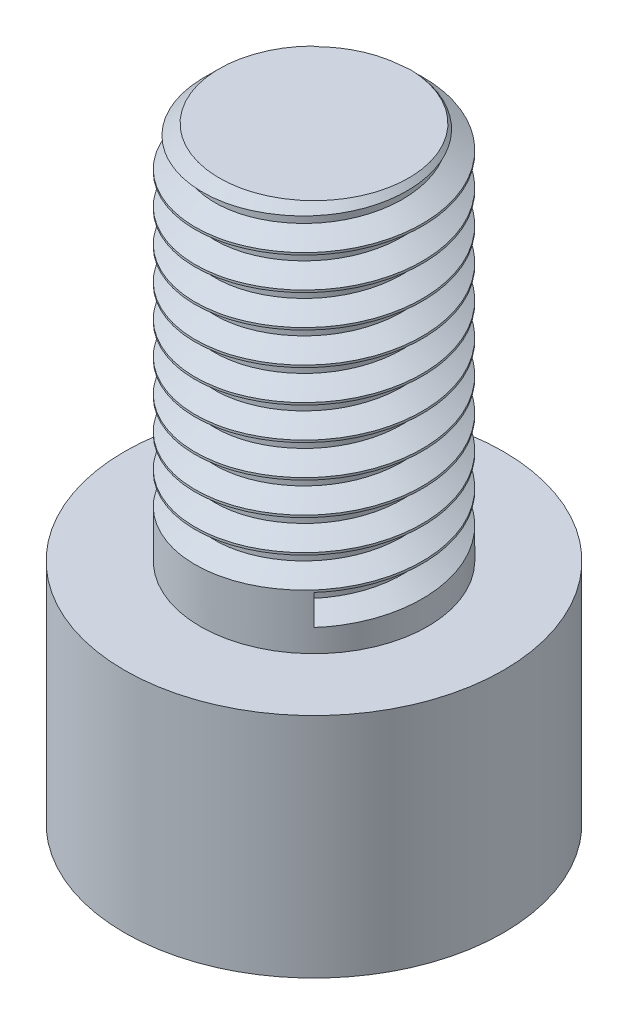
from build123d import *

# Parameters (mm, degrees)
IZIM1_R                     = 2.5
Y_KSEKLIK_EKSTR_ZYON2_DEPTH = 3
IZIM3_R                     = 1.5
Y_KSEKLIK_EKSTR_ZYON3_DEPTH = 5
PAH1_SIZE                   = 0.25
KES_S_P_R3_PITCH            = 0.428571429


with BuildPart() as part:
    # Çizim1 → Yükseklik-Ekstrüzyon2 (new body)
    with BuildSketch(Plane(origin=(0, 0, 0), x_dir=(1, 0, 0), z_dir=(0, 1, 0))):
        with Locations(Location((0, 0, 0), (0, 0, 270))):
            Circle(IZIM1_R)
    extrude(amount=Y_KSEKLIK_EKSTR_ZYON2_DEPTH)

    # Çizim3 → Yükseklik-Ekstrüzyon3 (add)
    with BuildSketch(Plane(origin=(0, 3, 0), x_dir=(1, 0, 0), z_dir=(0, 1, 0))):
        with Locations(Location((0, 0, 0), (0, 0, 270))):
            Circle(IZIM3_R)
    extrude(amount=Y_KSEKLIK_EKSTR_ZYON3_DEPTH)

    # Pah1
    pah1_edges = [part.edges().sort_by_distance(p)[0] for p in [
        (0, 8, -1.5),
    ]]
    chamfer(pah1_edges, length=PAH1_SIZE)

    # Kes-Süpür3: the profile of Çizim6 profile screwed along a right-hand helix of 10.5 turns, 6 arcs to a turn; built about Z, then put on its axis
    kes_s_p_r3_z = Axis((0, 0, 0), (0, 0, 1))
    kes_s_p_r3_corners = [(1.5003, 0, -0.200173205), (1.5003, 0, 0.200173205), (1.240192379, 0, 0.05), (1.240192379, 0, -0.05)]
    with BuildLine(mode=Mode.PRIVATE) as kes_s_p_r3_profile:
        Line(kes_s_p_r3_corners[0], kes_s_p_r3_corners[1])
        Line(kes_s_p_r3_corners[1], kes_s_p_r3_corners[2])
        Line(kes_s_p_r3_corners[2], kes_s_p_r3_corners[3])
        Line(kes_s_p_r3_corners[3], kes_s_p_r3_corners[0])
    kes_s_p_r3_cap = Face(kes_s_p_r3_profile.wire())
    kes_s_p_r3_turn_angles = [0, 30, 60, 90, 120, 150, 180, 210, 240, 270, 300, 330, 360]
    kes_s_p_r3_turn_weights = [1, 0.8660254037844387, 1, 0.8660254037844387, 1, 0.8660254037844387, 1, 0.8660254037844387, 1, 0.8660254037844387, 1, 0.8660254037844387, 1]
    kes_s_p_r3_turn_rails = [Edge.make_bspline([Vector(p[0], p[1], 0).rotate(kes_s_p_r3_z, kes_s_p_r3_turn_angles[k]) / kes_s_p_r3_turn_weights[k] + Vector(0, 0, p[2] + KES_S_P_R3_PITCH * kes_s_p_r3_turn_angles[k] / 360) for k in range(13)], [0, 0, 0, 1, 1, 2, 2, 3, 3, 4, 4, 5, 5, 6, 6, 6], 2, kes_s_p_r3_turn_weights) for p in kes_s_p_r3_corners]
    kes_s_p_r3_turn_sides = [Face.make_surface_from_curves(kes_s_p_r3_turn_rails[p[0]], kes_s_p_r3_turn_rails[p[1]]) for p in [(0, 1), (1, 2), (2, 3), (3, 0)]]
    kes_s_p_r3_last_angles = [3600, 3630, 3660, 3690, 3720, 3750, 3780]
    kes_s_p_r3_last_weights = [1, 0.8660254037844387, 1, 0.8660254037844387, 1, 0.8660254037844546, 1]
    kes_s_p_r3_last_rails = [Edge.make_bspline([Vector(p[0], p[1], 0).rotate(kes_s_p_r3_z, kes_s_p_r3_last_angles[k]) / kes_s_p_r3_last_weights[k] + Vector(0, 0, p[2] + KES_S_P_R3_PITCH * kes_s_p_r3_last_angles[k] / 360) for k in range(7)], [0, 0, 0, 1, 1, 2, 2, 3, 3, 3], 2, kes_s_p_r3_last_weights) for p in kes_s_p_r3_corners]
    kes_s_p_r3_last_sides = [Face.make_surface_from_curves(kes_s_p_r3_last_rails[p[0]], kes_s_p_r3_last_rails[p[1]]) for p in [(0, 1), (1, 2), (2, 3), (3, 0)]]
    kes_s_p_r3 = Plane(origin=(0, 8, 0), x_dir=(-0.7071067811865538, 0, -0.7071067811865414), z_dir=(0, -1, 0)) * Solid(Shell([*[p.moved(Location((0, 0, KES_S_P_R3_PITCH * i))) for i in range(10) for p in kes_s_p_r3_turn_sides], *kes_s_p_r3_last_sides, kes_s_p_r3_cap, kes_s_p_r3_cap.rotate(kes_s_p_r3_z, 3780).moved(Location((0, 0, KES_S_P_R3_PITCH * 3780 / 360)))]))
    add(kes_s_p_r3, mode=Mode.SUBTRACT)


solid = part.part
